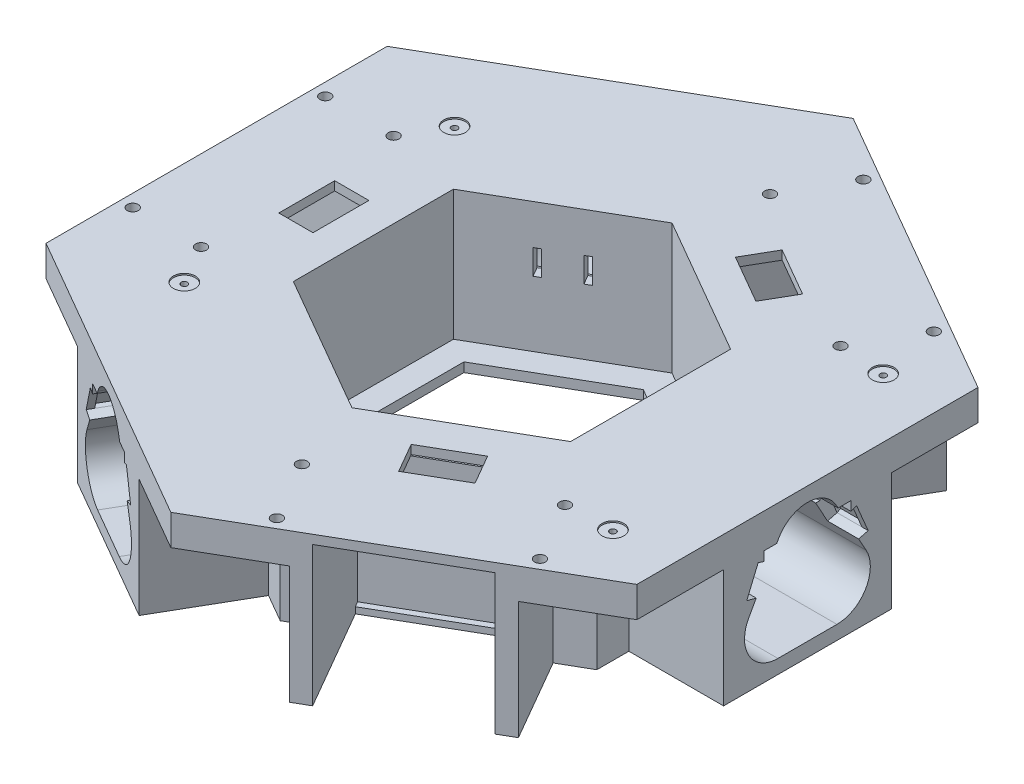
from build123d import *

# Parameters (mm, degrees)
RESSALTO_EXTRUS_O1_DEPTH  = 47.85
CORTE_EXTRUS_O1_DEPTH     = 153.974473143
CORTE_EXTRUS_O2_DEPTH     = 41.85
CORTE_EXTRUS_O3_DEPTH     = 3
CORTE_EXTRUS_O4_DEPTH     = 42.04
RESSALTO_EXTRUS_O2_DEPTH  = 2
CORTE_EXTRUS_O5_DEPTH     = 42.04
CORTE_EXTRUS_O6_DEPTH     = 42.04
RESSALTO_EXTRUS_O3_DEPTH  = 2
RESSALTO_EXTRUS_O4_DEPTH  = 2
CORTE_EXTRUS_O7_DEPTH     = 2.85
CORTE_EXTRUS_O8_DEPTH     = 37.5
CORTE_EXTRUS_O9_DEPTH     = 37.5
CORTE_EXTRUS_O10_DEPTH    = 37.5
CORTE_EXTRUS_O11_DEPTH    = 47
CORTE_EXTRUS_O12_DEPTH    = 47
CORTE_EXTRUS_O13_DEPTH    = 47
ESBO_O22_W                = 28
ESBO_O22_H                = 5
CORTE_EXTRUS_O17_DEPTH    = 47
ESBO_O23_W                = 28
ESBO_O23_H                = 5
CORTE_EXTRUS_O18_DEPTH    = 47
ESBO_O24_W                = 28
ESBO_O24_H                = 5
CORTE_EXTRUS_O19_DEPTH    = 47
CORTE_EXTRUS_O20_DEPTH    = 10
CORTE_EXTRUS_O21_DEPTH    = 10
CORTE_EXTRUS_O22_DEPTH    = 10
CORTE_EXTRUS_O23_DEPTH    = 1.5
CORTE_EXTRUS_O23_DRAFT    = 15
CORTE_EXTRUS_O24_DEPTH    = 1.5
CORTE_EXTRUS_O24_DRAFT    = 15
CORTE_EXTRUS_O25_DEPTH    = 1.5
CORTE_EXTRUS_O25_DRAFT    = 15
CORTE_EXTRUS_O26_DEPTH    = 1.5
CORTE_EXTRUS_O26_DRAFT    = 15
ESBO_O32_W                = 8
ESBO_O32_H                = 9.496241362
CORTE_EXTRUS_O27_DEPTH    = 1.5
CORTE_EXTRUS_O27_DRAFT    = 15
ESBO_O33_W                = 8
ESBO_O33_H                = 9.496241362
CORTE_EXTRUS_O28_DEPTH    = 1.5
CORTE_EXTRUS_O28_DRAFT    = 15
ESBO_O34_W                = 2
ESBO_O34_H                = 8
CORTE_EXTRUS_O29_DEPTH    = 78.5
ESBO_O35_W                = 2
ESBO_O35_H                = 8
CORTE_EXTRUS_O30_DEPTH    = 78.5
ESBO_O36_W                = 2
ESBO_O36_H                = 8
CORTE_EXTRUS_O31_DEPTH    = 78.5
CORTE_EXTRUS_O37_DEPTH    = 38
ESBO_O42_R                = 1.75
CORTE_EXTRUS_O38_DEPTH    = 153.974473143
ESBO_O43_R                = 3.5
CORTE_EXTRUS_O39_DEPTH    = 0.5
ESBO_O44_R                = 1
CORTE_EXTRUS_O40_DEPTH    = 8
ESBO_O45_W                = 18
ESBO_O45_H                = 2.85
RESSALTO_EXTRUS_O5_DEPTH  = 2.5
ESBO_O46_W                = 18
ESBO_O46_H                = 2.85
CORTE_EXTRUS_O41_DEPTH    = 2.5
ESBO_O47_W                = 43
ESBO_O47_H                = 43
RESSALTO_EXTRUS_O6_DEPTH  = 2.5
ESBO_O48_W                = 43
ESBO_O48_H                = 2
RESSALTO_EXTRUS_O7_DEPTH  = 2.5
ESBO_O49_W                = 43
ESBO_O49_H                = 2
RESSALTO_EXTRUS_O8_DEPTH  = 2.5
ESBO_O50_W                = 43
ESBO_O50_H                = 43
RESSALTO_EXTRUS_O9_DEPTH  = 2.5
ESBO_O51_W                = 18
ESBO_O51_H                = 2.85
RESSALTO_EXTRUS_O10_DEPTH = 2.5
ESBO_O52_W                = 18
ESBO_O52_H                = 2.85
CORTE_EXTRUS_O42_DEPTH    = 2.5
ESBO_O53_W                = 43
ESBO_O53_H                = 2
RESSALTO_EXTRUS_O11_DEPTH = 2.5
ESBO_O54_W                = 43
ESBO_O54_H                = 43
RESSALTO_EXTRUS_O12_DEPTH = 2.5
ESBO_O55_W                = 18
ESBO_O55_H                = 2.85
RESSALTO_EXTRUS_O14_DEPTH = 2.5
ESBO_O56_W                = 18
ESBO_O56_H                = 2.85
CORTE_EXTRUS_O43_DEPTH    = 2.5


with BuildPart() as part:
    # Esboço1 → Ressalto-extrusão1 (new body)
    with BuildSketch(Plane(origin=(0, 0, 0), x_dir=(1, 0, 0), z_dir=(0, 1, 0))):
        Polygon((-95.12, 54.917557605), (-95.12, -54.917557605), (0, -109.835115211), (95.12, -54.917557605), (95.12, 54.917557605), (0, 109.835115211), align=None)
    extrude(amount=RESSALTO_EXTRUS_O1_DEPTH)

    # Esboço2 → Corte-extrusão1 (cut, through all)
    with BuildSketch(Plane(origin=(0, 47.85, 0), x_dir=(1, 0, 0), z_dir=(0, 1, 0))):
        Polygon((-36.62, 21.142566858), (-36.62, -21.142566858), (0, -42.285133715), (36.62, -21.142566858), (36.62, 21.142566858), (0, 42.285133715), align=None)
    extrude(amount=-CORTE_EXTRUS_O1_DEPTH, mode=Mode.SUBTRACT)

    # Esboço3 → Corte-extrusão2 (cut)
    with BuildSketch(Plane(origin=(0, 47.85, 0), x_dir=(1, 0, 0), z_dir=(0, 1, 0))):
        Polygon((44.62, 25.761369011), (44.62, -25.761369011), (0, -51.522738022), (-44.62, -25.761369011), (-44.62, 25.761369011), (0, 51.522738022), align=None)
    extrude(amount=-CORTE_EXTRUS_O2_DEPTH, mode=Mode.SUBTRACT)

    # Esboço4 → Corte-extrusão3 (cut)
    with BuildSketch(Plane(origin=(0, 0, 0), x_dir=(-1, 0, 0), z_dir=(0, -1, 0))):
        Polygon((-44.62, -25.761369011), (-44.62, 25.761369011), (0, 51.522738022), (44.62, 25.761369011), (44.62, -25.761369011), (0, -51.522738022), align=None)
    extrude(amount=-CORTE_EXTRUS_O3_DEPTH, mode=Mode.SUBTRACT)

    # Esboço5 → Corte-extrusão4 (cut)
    with BuildSketch(Plane.ZY.offset(95.12)):
        Polygon((0, 45), (-21.5, 45), (-21.5, 0), (21.5, 0), (21.5, 45), align=None)
    extrude(amount=-CORTE_EXTRUS_O4_DEPTH, mode=Mode.SUBTRACT)

    # Esboço6 → Ressalto-extrusão2 (add)
    with BuildSketch(Plane.ZY.offset(53.08)):
        Polygon((0, 0), (21.5, 0), (21.5, 2), (-21.5, 2), (-21.5, 0), align=None)
    extrude(amount=RESSALTO_EXTRUS_O2_DEPTH)

    # Esboço7 → Corte-extrusão5 (cut)
    with BuildSketch(Plane(origin=(47.56, 0, -82.376336408), x_dir=(-0.8660254037844387, 0, -0.49999999999999994), z_dir=(0.4999999999999999, 0, -0.8660254037844386))):
        Polygon((0, 45), (21.5, 45), (21.5, 0), (-21.5, 0), (-21.5, 45), align=None)
    extrude(amount=-CORTE_EXTRUS_O5_DEPTH, mode=Mode.SUBTRACT)

    # Esboço8 → Corte-extrusão6 (cut)
    with BuildSketch(Plane(origin=(47.56, 0, 82.376336408), x_dir=(0.8660254037844386, 0, -0.5000000000000003), z_dir=(0.5000000000000003, 0, 0.8660254037844386))):
        Polygon((0, 45), (21.5, 45), (21.5, 0), (-21.5, 0), (-21.5, 45), align=None)
    extrude(amount=-CORTE_EXTRUS_O6_DEPTH, mode=Mode.SUBTRACT)

    # Esboço9 → Ressalto-extrusão3 (add)
    with BuildSketch(Plane(origin=(26.54, 0, 45.968628433), x_dir=(0.8660254037844384, 0, -0.5000000000000006), z_dir=(0.5000000000000006, 0, 0.8660254037844384))):
        Polygon((0, 0), (21.5, 0), (21.5, 2), (-21.5, 2), (-21.5, 0), align=None)
    extrude(amount=RESSALTO_EXTRUS_O3_DEPTH)

    # Esboço10 → Ressalto-extrusão4 (add)
    with BuildSketch(Plane(origin=(26.54, 0, -45.968628433), x_dir=(-0.8660254037844387, 0, -0.49999999999999983), z_dir=(0.49999999999999983, 0, -0.8660254037844387))):
        Polygon((0, 0), (21.5, 0), (21.5, 2), (-21.5, 2), (-21.5, 0), align=None)
    extrude(amount=RESSALTO_EXTRUS_O4_DEPTH)

    # Esboço11 → Corte-extrusão7 (cut)
    with BuildSketch(Plane(origin=(0, 47.85, 0), x_dir=(1, 0, 0), z_dir=(0, 1, 0))):
        Polygon((-52.58, 0), (-52.58, 9), (-63.58, 9), (-63.58, -9), (-52.58, -9), align=None)
        Polygon((26.29, 45.535615731), (34.084228634, 41.035615731), (39.584228634, 50.561895173), (23.995771366, 59.561895173), (18.495771366, 50.035615731), align=None)
        Polygon((26.29, -45.535615731), (18.495771366, -50.035615731), (23.995771366, -59.561895173), (39.584228634, -50.561895173), (34.084228634, -41.035615731), align=None)
    extrude(amount=-CORTE_EXTRUS_O7_DEPTH, mode=Mode.SUBTRACT)

    # Esboço12 → Corte-extrusão8 (cut)
    with BuildSketch(Plane(origin=(95.12, 0, 0), x_dir=(0, 0, -1), z_dir=(1, 0, 0))):
        with BuildLine():
            Line((-9.315367954, 37.762017036), (-18.902836198, 20.460486679))
            ThreePointArc((-18.902836198, 20.460486679), (-18.762160434, 9.793363298), (-9.5, 4.5))
            Line((-9.5, 4.5), (9.5, 4.5))
            ThreePointArc((9.5, 4.5), (18.762160434, 9.793363298), (18.902836198, 20.460486679))
            Line((18.902836198, 20.460486679), (9.315367954, 37.762017036))
            ThreePointArc((9.315367954, 37.762017036), (0, 43.25), (-9.315367954, 37.762017036))
        make_face()
    extrude(amount=-CORTE_EXTRUS_O8_DEPTH, mode=Mode.SUBTRACT)

    # Esboço13 → Corte-extrusão9 (cut)
    with BuildSketch(Plane(origin=(-47.56, 0, 82.376336408), x_dir=(0.8660254037844386, 0, 0.5000000000000003), z_dir=(-0.5000000000000002, 0, 0.8660254037844385))):
        with BuildLine():
            Line((-9.315367954, 37.762017036), (-18.902836198, 20.460486679))
            ThreePointArc((-18.902836198, 20.460486679), (-18.762160434, 9.793363298), (-9.5, 4.5))
            Line((-9.5, 4.5), (9.5, 4.5))
            ThreePointArc((9.5, 4.5), (18.762160434, 9.793363298), (18.902836198, 20.460486679))
            Line((18.902836198, 20.460486679), (9.315367954, 37.762017036))
            ThreePointArc((9.315367954, 37.762017036), (0, 43.25), (-9.315367954, 37.762017036))
        make_face()
    extrude(amount=-CORTE_EXTRUS_O9_DEPTH, mode=Mode.SUBTRACT)

    # Esboço14 → Corte-extrusão10 (cut)
    with BuildSketch(Plane(origin=(-47.56, 0, -82.376336408), x_dir=(-0.8660254037844386, 0, 0.5000000000000003), z_dir=(-0.5000000000000002, 0, -0.8660254037844385))):
        with BuildLine():
            Line((-9.315367954, 37.762017036), (-18.902836198, 20.460486679))
            ThreePointArc((-18.902836198, 20.460486679), (-18.762160434, 9.793363298), (-9.5, 4.5))
            Line((-9.5, 4.5), (9.5, 4.5))
            ThreePointArc((9.5, 4.5), (18.762160434, 9.793363298), (18.902836198, 20.460486679))
            Line((18.902836198, 20.460486679), (9.315367954, 37.762017036))
            ThreePointArc((9.315367954, 37.762017036), (0, 43.25), (-9.315367954, 37.762017036))
        make_face()
    extrude(amount=-CORTE_EXTRUS_O10_DEPTH, mode=Mode.SUBTRACT)

    # Esboço15 → Corte-extrusão11 (cut)
    with BuildSketch(Plane(origin=(95.12, 0, 0), x_dir=(0, 0, -1), z_dir=(1, 0, 0))):
        with BuildLine():
            Line((-9.315367954, 37.762017036), (-18.88094029, 20.5))
            Line((-18.88094029, 20.5), (18.88094029, 20.5))
            Line((18.88094029, 20.5), (9.315367954, 37.762017036))
            ThreePointArc((9.315367954, 37.762017036), (0, 43.25), (-9.315367954, 37.762017036))
        make_face()
    extrude(amount=-CORTE_EXTRUS_O11_DEPTH, mode=Mode.SUBTRACT)

    # Esboço16 → Corte-extrusão12 (cut)
    with BuildSketch(Plane(origin=(-47.56, 0, -82.376336408), x_dir=(-0.8660254037844386, 0, 0.5000000000000003), z_dir=(-0.5000000000000002, 0, -0.8660254037844385))):
        with BuildLine():
            Line((9.315367954, 37.762017036), (18.902836198, 20.460486679))
            ThreePointArc((18.902836198, 20.460486679), (18.891854639, 20.480254912), (18.880831519, 20.500000001))
            Line((18.880831519, 20.500000001), (-18.88083152, 20.500000001))
            ThreePointArc((-18.88083152, 20.500000001), (-18.89185464, 20.480254911), (-18.9028362, 20.460486677))
            Line((-18.9028362, 20.460486677), (-9.315367954, 37.762017036))
            ThreePointArc((-9.315367954, 37.762017036), (0, 43.25), (9.315367954, 37.762017036))
        make_face()
    extrude(amount=-CORTE_EXTRUS_O12_DEPTH, mode=Mode.SUBTRACT)

    # Esboço17 → Corte-extrusão13 (cut)
    with BuildSketch(Plane(origin=(-47.56, 0, 82.376336408), x_dir=(0.8660254037844386, 0, 0.5000000000000003), z_dir=(-0.5000000000000002, 0, 0.8660254037844385))):
        with BuildLine():
            Line((-9.315367954, 37.762017036), (-18.88094029, 20.5))
            Line((-18.88094029, 20.5), (18.88094029, 20.5))
            Line((18.88094029, 20.5), (9.315367954, 37.762017036))
            ThreePointArc((9.315367954, 37.762017036), (0, 43.25), (-9.315367954, 37.762017036))
        make_face()
    extrude(amount=-CORTE_EXTRUS_O13_DEPTH, mode=Mode.SUBTRACT)

    # Esboço22 → Corte-extrusão17 (cut)
    with BuildSketch(Plane(origin=(95.12, 0, 0), x_dir=(0, 0, -1), z_dir=(1, 0, 0))):
        with Locations((0, 34.25)):
            Rectangle(ESBO_O22_W, ESBO_O22_H)
    extrude(amount=-CORTE_EXTRUS_O17_DEPTH, mode=Mode.SUBTRACT)

    # Esboço23 → Corte-extrusão18 (cut)
    with BuildSketch(Plane(origin=(-47.56, 0, -82.376336408), x_dir=(-0.8660254037844386, 0, 0.5000000000000003), z_dir=(-0.5000000000000002, 0, -0.8660254037844385))):
        with Locations((0, 34.25)):
            Rectangle(ESBO_O23_W, ESBO_O23_H)
    extrude(amount=-CORTE_EXTRUS_O18_DEPTH, mode=Mode.SUBTRACT)

    # Esboço24 → Corte-extrusão19 (cut)
    with BuildSketch(Plane(origin=(-47.56, 0, 82.376336408), x_dir=(0.8660254037844386, 0, 0.5000000000000003), z_dir=(-0.5000000000000002, 0, 0.8660254037844385))):
        with Locations((0, 34.25)):
            Rectangle(ESBO_O24_W, ESBO_O24_H)
    extrude(amount=-CORTE_EXTRUS_O19_DEPTH, mode=Mode.SUBTRACT)

    # Esboço25 → Corte-extrusão20 (cut)
    with BuildSketch(Plane(origin=(95.12, 0, 0), x_dir=(0, 0, -1), z_dir=(1, 0, 0))):
        Polygon((-15.86, 34.37), (0, 29.25), (15.86, 34.37), (19.55, 25.62), (0, 20.5), (-19.55, 25.62), align=None)
    extrude(amount=-CORTE_EXTRUS_O20_DEPTH, mode=Mode.SUBTRACT)

    # Esboço26 → Corte-extrusão21 (cut)
    with BuildSketch(Plane(origin=(-47.56, 0, -82.376336408), x_dir=(-0.8660254037844386, 0, 0.5000000000000003), z_dir=(-0.5000000000000002, 0, -0.8660254037844385))):
        Polygon((-15.86, 34.37), (0, 29.250000001), (15.86, 34.37), (19.55, 25.62), (0, 20.500000001), (-19.55, 25.62), align=None)
    extrude(amount=-CORTE_EXTRUS_O21_DEPTH, mode=Mode.SUBTRACT)

    # Esboço27 → Corte-extrusão22 (cut)
    with BuildSketch(Plane(origin=(-47.56, 0, 82.376336408), x_dir=(0.8660254037844386, 0, 0.5000000000000003), z_dir=(-0.5000000000000002, 0, 0.8660254037844385))):
        Polygon((-15.86, 34.37), (0, 29.250000001), (15.86, 34.37), (19.55, 25.62), (0, 20.500000001), (-19.55, 25.62), align=None)
    extrude(amount=-CORTE_EXTRUS_O22_DEPTH, mode=Mode.SUBTRACT)


with BuildPart() as corte_extrus_o23_tool:
    # Esboço28 → Corte-extrusão23 (with draft: the straight prism first)
    with BuildSketch(Plane(origin=(22.318435989, 10.868045268, -12.885555026), x_dir=(0.4142091718091397, 0.20170069407025842, 0.8875514587902849), z_dir=(-0.7979706911896647, -0.38857479074568324, 0.460708593363785))):
        Polygon((-87.356884839, 36.005991862), (-79.550911268, 34.2547704), (-77.472158558, 43.520696537), (-85.278132129, 45.271917999), align=None)
    extrude(amount=-CORTE_EXTRUS_O23_DEPTH)
    # Corte-extrusão23: the draft: its side faces are tilted about the plane it starts from
    corte_extrus_o23_sides = [corte_extrus_o23_tool.faces().sort_by_distance(p)[0] for p in [
        (-27.030725338, 25.911431093, -87.30071543),
        (-26.628542208, 30.286431093, -82.914113815),
        (-30.226359078, 34.661431093, -85.45571543),
        (-30.628542208, 30.286431093, -89.842317045),
    ]]
    draft(corte_extrus_o23_sides, Plane(origin=(22.318435989, 10.868045268, -12.885555026), x_dir=(0.4142091718091397, 0.20170069407025842, 0.8875514587902849), z_dir=(-0.7979706911896647, -0.38857479074568324, 0.460708593363785)), CORTE_EXTRUS_O23_DRAFT)


with BuildPart() as part_1:
    add(part.part)

    # Corte-extrusão23: cut by corte_extrus_o23_tool
    add(corte_extrus_o23_tool.part, mode=Mode.SUBTRACT)


with BuildPart() as corte_extrus_o24_tool:
    # Esboço29 → Corte-extrusão24 (with draft: the straight prism first)
    with BuildSketch(Plane(origin=(-22.318435989, 10.868045268, 12.885555026), x_dir=(-0.41420917180913963, 0.2017006940702585, -0.8875514587902849), z_dir=(0.7979706911896646, -0.3885747907456835, -0.460708593363785))):
        Polygon((94.366179896, -4.762443766), (96.444932605, 4.503482371), (88.638959034, 6.254703832), (86.560206324, -3.011222304), align=None)
    extrude(amount=-CORTE_EXTRUS_O24_DEPTH)
    # Corte-extrusão24: the draft: its side faces are tilted about the plane it starts from
    corte_extrus_o24_sides = [corte_extrus_o24_tool.faces().sort_by_distance(p)[0] for p in [
        (-62.491457792, 30.286431093, -71.446254155),
        (-58.893640922, 34.661431093, -68.90465254),
        (-58.491457792, 30.286431093, -64.518050925),
        (-62.089274662, 25.911431093, -67.05965254),
    ]]
    draft(corte_extrus_o24_sides, Plane(origin=(-22.318435989, 10.868045268, 12.885555026), x_dir=(-0.41420917180913963, 0.2017006940702585, -0.8875514587902849), z_dir=(0.7979706911896646, -0.3885747907456835, -0.460708593363785)), CORTE_EXTRUS_O24_DRAFT)


with BuildPart() as part_2:
    add(part_1.part)

    # Corte-extrusão24: cut by corte_extrus_o24_tool
    add(corte_extrus_o24_tool.part, mode=Mode.SUBTRACT)


with BuildPart() as corte_extrus_o25_tool:
    # Esboço30 → Corte-extrusão25 (with draft: the straight prism first)
    with BuildSketch(Plane(origin=(-22.318435989, 10.868045268, -12.885555026), x_dir=(0.41420917180913963, -0.2017006940702585, -0.8875514587902849), z_dir=(0.7979706911896646, -0.3885747907456835, 0.460708593363785))):
        Polygon((-94.366179896, -4.762443766), (-86.560206324, -3.011222304), (-88.638959034, 6.254703832), (-96.444932605, 4.503482371), align=None)
    extrude(amount=-CORTE_EXTRUS_O25_DEPTH)
    # Corte-extrusão25: the draft: its side faces are tilted about the plane it starts from
    corte_extrus_o25_sides = [corte_extrus_o25_tool.faces().sort_by_distance(p)[0] for p in [
        (-62.089274662, 25.911431093, 67.05965254),
        (-58.491457792, 30.286431093, 64.518050925),
        (-58.893640922, 34.661431093, 68.90465254),
        (-62.491457792, 30.286431093, 71.446254155),
    ]]
    draft(corte_extrus_o25_sides, Plane(origin=(-22.318435989, 10.868045268, -12.885555026), x_dir=(0.41420917180913963, -0.2017006940702585, -0.8875514587902849), z_dir=(0.7979706911896646, -0.3885747907456835, 0.460708593363785)), CORTE_EXTRUS_O25_DRAFT)


with BuildPart() as part_3:
    add(part_2.part)

    # Corte-extrusão25: cut by corte_extrus_o25_tool
    add(corte_extrus_o25_tool.part, mode=Mode.SUBTRACT)


with BuildPart() as corte_extrus_o26_tool:
    # Esboço31 → Corte-extrusão26 (with draft: the straight prism first)
    with BuildSketch(Plane(origin=(22.318435989, 10.868045268, 12.885555026), x_dir=(-0.41420917180913985, -0.20170069407025834, 0.8875514587902849), z_dir=(-0.7979706911896647, -0.388574790745683, -0.46070859336378506))):
        Polygon((85.278132129, 45.271917999), (77.472158558, 43.520696537), (79.550911268, 34.2547704), (87.356884839, 36.005991862), align=None)
    extrude(amount=-CORTE_EXTRUS_O26_DEPTH)
    # Corte-extrusão26: the draft: its side faces are tilted about the plane it starts from
    corte_extrus_o26_sides = [corte_extrus_o26_tool.faces().sort_by_distance(p)[0] for p in [
        (-30.226359078, 34.661431093, 85.45571543),
        (-26.628542208, 30.286431093, 82.914113815),
        (-27.030725338, 25.911431093, 87.30071543),
        (-30.628542208, 30.286431093, 89.842317045),
    ]]
    draft(corte_extrus_o26_sides, Plane(origin=(22.318435989, 10.868045268, 12.885555026), x_dir=(-0.41420917180913985, -0.20170069407025834, 0.8875514587902849), z_dir=(-0.7979706911896647, -0.388574790745683, -0.46070859336378506)), CORTE_EXTRUS_O26_DRAFT)


with BuildPart() as part_4:
    add(part_3.part)

    # Corte-extrusão26: cut by corte_extrus_o26_tool
    add(corte_extrus_o26_tool.part, mode=Mode.SUBTRACT)


with BuildPart() as corte_extrus_o27_tool:
    # Esboço32 → Corte-extrusão27 (with draft: the straight prism first)
    with BuildSketch(Plane(origin=(0, 10.868045268, -25.771110053), x_dir=(1, 0, 0), z_dir=(0, -0.3885747907456834, 0.9214171867275693))):
        with Locations((89.12, 20.758191846)):
            Rectangle(ESBO_O32_W, ESBO_O32_H)
    extrude(amount=-CORTE_EXTRUS_O27_DEPTH)
    # Corte-extrusão27: the draft: its side faces are tilted about the plane it starts from
    corte_extrus_o27_sides = [corte_extrus_o27_tool.faces().sort_by_distance(p)[0] for p in [
        (93.12, 30.286431093, -18.39606289),
        (89.12, 34.661431093, -16.55106289),
        (85.12, 30.286431093, -18.39606289),
        (89.12, 25.911431093, -20.24106289),
    ]]
    draft(corte_extrus_o27_sides, Plane(origin=(0, 10.868045268, -25.771110053), x_dir=(1, 0, 0), z_dir=(0, -0.3885747907456834, 0.9214171867275693)), CORTE_EXTRUS_O27_DRAFT)


with BuildPart() as part_5:
    add(part_4.part)

    # Corte-extrusão27: cut by corte_extrus_o27_tool
    add(corte_extrus_o27_tool.part, mode=Mode.SUBTRACT)


with BuildPart() as corte_extrus_o28_tool:
    # Esboço33 → Corte-extrusão28 (with draft: the straight prism first)
    with BuildSketch(Plane(origin=(0, 10.868045268, 25.771110053), x_dir=(-1, 0, 0), z_dir=(0, -0.38857479074568413, -0.921417186727569))):
        with Locations((-89.12, 20.758191846)):
            Rectangle(ESBO_O33_W, ESBO_O33_H)
    extrude(amount=-CORTE_EXTRUS_O28_DEPTH)
    # Corte-extrusão28: the draft: its side faces are tilted about the plane it starts from
    corte_extrus_o28_sides = [corte_extrus_o28_tool.faces().sort_by_distance(p)[0] for p in [
        (85.12, 30.286431093, 18.39606289),
        (89.12, 34.661431093, 16.55106289),
        (93.12, 30.286431093, 18.39606289),
        (89.12, 25.911431093, 20.24106289),
    ]]
    draft(corte_extrus_o28_sides, Plane(origin=(0, 10.868045268, 25.771110053), x_dir=(-1, 0, 0), z_dir=(0, -0.38857479074568413, -0.921417186727569)), CORTE_EXTRUS_O28_DRAFT)


with BuildPart() as part_6:
    add(part_5.part)

    # Corte-extrusão28: cut by corte_extrus_o28_tool
    add(corte_extrus_o28_tool.part, mode=Mode.SUBTRACT)

    # Esboço34 → Corte-extrusão29 (cut)
    with BuildSketch(Plane(origin=(95.12, 0, 0), x_dir=(0, 0, -1), z_dir=(1, 0, 0))):
        with Locations((-6, 31)):
            Rectangle(ESBO_O34_W, ESBO_O34_H)
        with Locations((6, 31)):
            Rectangle(ESBO_O34_W, ESBO_O34_H)
    extrude(amount=-CORTE_EXTRUS_O29_DEPTH, mode=Mode.SUBTRACT)

    # Esboço35 → Corte-extrusão30 (cut)
    with BuildSketch(Plane(origin=(-47.56, 0, -82.376336408), x_dir=(-0.8660254037844386, 0, 0.5000000000000003), z_dir=(-0.5000000000000002, 0, -0.8660254037844385))):
        with Locations((-6, 31)):
            Rectangle(ESBO_O35_W, ESBO_O35_H)
        with Locations((6, 31)):
            Rectangle(ESBO_O35_W, ESBO_O35_H)
    extrude(amount=-CORTE_EXTRUS_O30_DEPTH, mode=Mode.SUBTRACT)

    # Esboço36 → Corte-extrusão31 (cut)
    with BuildSketch(Plane(origin=(-47.56, 0, 82.376336408), x_dir=(0.8660254037844386, 0, 0.5000000000000003), z_dir=(-0.5000000000000002, 0, 0.8660254037844385))):
        with Locations((-6, 31)):
            Rectangle(ESBO_O36_W, ESBO_O36_H)
        with Locations((6, 31)):
            Rectangle(ESBO_O36_W, ESBO_O36_H)
    extrude(amount=-CORTE_EXTRUS_O31_DEPTH, mode=Mode.SUBTRACT)

    # Esboço38 → Corte-extrusão37 (cut)
    with BuildSketch(Plane(origin=(0, 0, 0), x_dir=(-1, 0, 0), z_dir=(0, -1, 0))):
        Polygon((-8.927314098, 69.462561593), (0, 74.61674879), (8.927314098, 69.462561593), (40.030647431, 123.335115211), (18.309407452, 159.839588634), (-48.99486696, 151.980178412), (-101.301590853, 133.332712728), (-152.343164681, 37.308374395), (-152.343164681, -27), (-135.367685756, -74.61674879), (-101.301590853, -126.108710312), (-79.337280437, -147.887013534), (8.927314098, -147.887013534), (86.796019236, -138.793949202), (119.671066593, -105.638118019), (144.165227035, -63.212987645), (157.565931851, 0), (144.165227035, 53.198628844), (86.796019236, 96.335115211), (55.692685902, 42.462561593), (64.62, 37.308374395), (64.62, 27), (126.826666667, 27), (126.826666667, -27), (64.62, -27), (64.62, -37.308374395), (55.692685902, -42.462561593), (86.796019236, -96.335115211), (40.030647431, -123.335115211), (8.927314098, -69.462561593), (0, -74.61674879), (-8.927314098, -69.462561593), (-40.030647431, -123.335115211), (-86.796019236, -96.335115211), (-55.692685902, -42.462561593), (-64.62, -37.308374395), (-64.62, -27), (-126.826666667, -27), (-126.826666667, 27), (-64.62, 27), (-64.62, 37.308374395), (-55.692685902, 42.462561593), (-86.796019235, 96.335115211), (-40.030647431, 123.335115211), align=None)
    extrude(amount=-CORTE_EXTRUS_O37_DEPTH, mode=Mode.SUBTRACT)

    # Esboço42 → Corte-extrusão38 (cut, through all)
    with BuildSketch(Plane(origin=(0, 47.85, 0), x_dir=(1, 0, 0), z_dir=(0, 1, 0))):
        with Locations((18.713212483, 94.412234793)):
            Circle(ESBO_O42_R)
        with Locations((61.406787517, -44.35967591)):
            Circle(ESBO_O42_R)
        with Locations((-91.12, 31)):
            Circle(ESBO_O42_R)
        with Locations((18.713212483, -94.412234793)):
            Circle(ESBO_O42_R)
        with Locations((-91.12, -31)):
            Circle(ESBO_O42_R)
        with Locations((7.713212483, -75.35967591)):
            Circle(ESBO_O42_R)
        with Locations((72.406787517, -63.412234793)):
            Circle(ESBO_O42_R)
        with Locations((-69.12, 31)):
            Circle(ESBO_O42_R)
        with Locations((61.406787517, 44.35967591)):
            Circle(ESBO_O42_R)
        with Locations((7.713212483, 75.35967591)):
            Circle(ESBO_O42_R)
        with Locations((-69.12, -31)):
            Circle(ESBO_O42_R)
        with Locations((72.406787517, 63.412234793)):
            Circle(ESBO_O42_R)
    extrude(amount=-CORTE_EXTRUS_O38_DEPTH, mode=Mode.SUBTRACT)

    # Esboço43 → Corte-extrusão39 (cut)
    with BuildSketch(Plane(origin=(0, 47.85, 0), x_dir=(1, 0, 0), z_dir=(0, 1, 0))):
        with Locations((-62, 43.5)):
            Circle(ESBO_O43_R)
        with Locations((76, 43.5)):
            Circle(ESBO_O43_R)
        with Locations((-62, -43.5)):
            Circle(ESBO_O43_R)
        with Locations((76, -43.5)):
            Circle(ESBO_O43_R)
    extrude(amount=-CORTE_EXTRUS_O39_DEPTH, mode=Mode.SUBTRACT)

    # Esboço44 → Corte-extrusão40 (cut)
    with BuildSketch(Plane(origin=(0, 47.85, 0), x_dir=(1, 0, 0), z_dir=(0, 1, 0))):
        with Locations((-62, 43.5)):
            Circle(ESBO_O44_R)
        with Locations((76, 43.5)):
            Circle(ESBO_O44_R)
        with Locations((76, -43.5)):
            Circle(ESBO_O44_R)
        with Locations((-62, -43.5)):
            Circle(ESBO_O44_R)
    extrude(amount=-CORTE_EXTRUS_O40_DEPTH, mode=Mode.SUBTRACT)

    # Esboço45 → Ressalto-extrusão5 (add)
    with BuildSketch(Plane(origin=(26.29, 0, 45.535615731), x_dir=(0.8660254037844364, 0, -0.5000000000000039), z_dir=(0.5000000000000039, 0, 0.8660254037844364))):
        with Locations((0, 46.425)):
            Rectangle(ESBO_O45_W, ESBO_O45_H)
    extrude(amount=RESSALTO_EXTRUS_O5_DEPTH)

    # Esboço46 → Corte-extrusão41 (cut)
    with BuildSketch(Plane(origin=(31.79, 0, 55.061895173), x_dir=(-0.8660254037844386, 0, 0.5000000000000001), z_dir=(-0.5000000000000001, 0, -0.8660254037844386))):
        with Locations((0, 46.425)):
            Rectangle(ESBO_O46_W, ESBO_O46_H)
    extrude(amount=-CORTE_EXTRUS_O41_DEPTH, mode=Mode.SUBTRACT)

    # Esboço47 → Ressalto-extrusão6 (add)
    with BuildSketch(Plane(origin=(26.54, 0, 45.968628433), x_dir=(0.8660254037844384, 0, -0.5000000000000006), z_dir=(0.5000000000000006, 0, 0.8660254037844384))):
        with Locations((0, 23.5)):
            Rectangle(ESBO_O47_W, ESBO_O47_H)
    extrude(amount=RESSALTO_EXTRUS_O6_DEPTH)

    # Esboço48 → Ressalto-extrusão7 (add)
    with BuildSketch(Plane(origin=(27.54, 0, 47.70067924), x_dir=(0.8660254037844384, 1.0015430658247747e-15, -0.5000000000000004), z_dir=(0.5000000000000004, -1.734723475976808e-15, 0.8660254037844384))):
        with Locations((0, 1)):
            Rectangle(ESBO_O48_W, ESBO_O48_H)
    extrude(amount=RESSALTO_EXTRUS_O7_DEPTH)

    # Esboço49 → Ressalto-extrusão8 (add)
    with BuildSketch(Plane(origin=(27.54, 0, -47.70067924), x_dir=(-0.8660254037844388, 0, -0.4999999999999997), z_dir=(0.49999999999999983, 0, -0.8660254037844389))):
        with Locations((0, 1)):
            Rectangle(ESBO_O49_W, ESBO_O49_H)
    extrude(amount=RESSALTO_EXTRUS_O8_DEPTH)

    # Esboço50 → Ressalto-extrusão9 (add)
    with BuildSketch(Plane(origin=(26.54, 0, -45.968628433), x_dir=(-0.8660254037844387, 0, -0.49999999999999983), z_dir=(0.49999999999999983, 0, -0.8660254037844387))):
        with Locations((0, 23.5)):
            Rectangle(ESBO_O50_W, ESBO_O50_H)
    extrude(amount=RESSALTO_EXTRUS_O9_DEPTH)

    # Esboço51 → Ressalto-extrusão10 (add)
    with BuildSketch(Plane(origin=(26.29, 0, -45.535615731), x_dir=(-0.8660254037844383, 0, -0.5000000000000008), z_dir=(0.5000000000000007, 0, -0.8660254037844382))):
        with Locations((0, 46.425)):
            Rectangle(ESBO_O51_W, ESBO_O51_H)
    extrude(amount=RESSALTO_EXTRUS_O10_DEPTH)

    # Esboço52 → Corte-extrusão42 (cut)
    with BuildSketch(Plane(origin=(31.79, 0, -55.061895173), x_dir=(0.8660254037844383, 0, 0.5000000000000008), z_dir=(-0.5000000000000007, 0, 0.8660254037844382))):
        with Locations((0, 46.425)):
            Rectangle(ESBO_O52_W, ESBO_O52_H)
    extrude(amount=-CORTE_EXTRUS_O42_DEPTH, mode=Mode.SUBTRACT)

    # Esboço53 → Ressalto-extrusão11 (add)
    with BuildSketch(Plane.ZY.offset(55.08)):
        with Locations((0, 1)):
            Rectangle(ESBO_O53_W, ESBO_O53_H)
    extrude(amount=RESSALTO_EXTRUS_O11_DEPTH)

    # Esboço54 → Ressalto-extrusão12 (add)
    with BuildSketch(Plane.ZY.offset(53.08)):
        with Locations((0, 23.5)):
            Rectangle(ESBO_O54_W, ESBO_O54_H)
    extrude(amount=RESSALTO_EXTRUS_O12_DEPTH)

    # Esboço55 → Ressalto-extrusão14 (add)
    with BuildSketch(Plane.ZY.offset(52.58)):
        with Locations((0, 46.425)):
            Rectangle(ESBO_O55_W, ESBO_O55_H)
    extrude(amount=RESSALTO_EXTRUS_O14_DEPTH)

    # Esboço56 → Corte-extrusão43 (cut)
    with BuildSketch(Plane(origin=(-63.58, 0, 0), x_dir=(0, 0, -1), z_dir=(1, 0, 0))):
        with Locations((0, 46.425)):
            Rectangle(ESBO_O56_W, ESBO_O56_H)
    extrude(amount=-CORTE_EXTRUS_O43_DEPTH, mode=Mode.SUBTRACT)


solid = part_6.part
